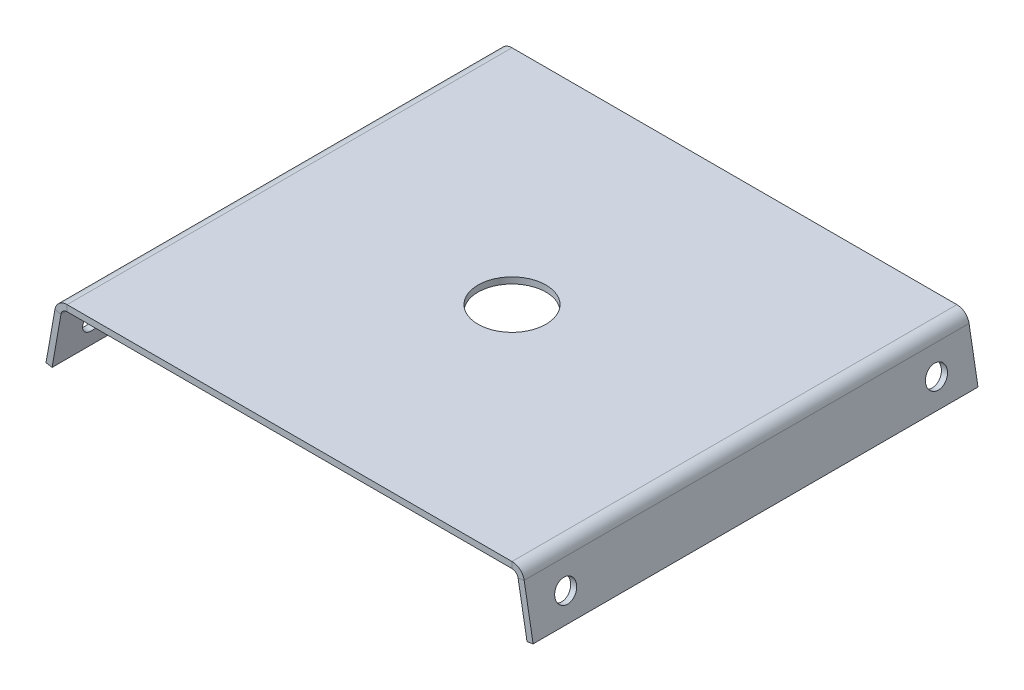
from build123d import *

# Parameters (mm, degrees)
SKETCH5_W               = 228.6
SKETCH5_H               = 228.6
SKETCH5_R               = 17.4625
BOSS_EXTRUDE3_DEPTH     = 3.175
EDGE_FLANGE1_DEPTH      = 228.6
EDGE_FLANGE1_BEND_DEPTH = 228.6
SKETCH17_R              = 5.588
CUT_EXTRUDE1_DEPTH      = 3.175


# Sheet-metal steps are written as plain solids
with BuildPart() as part:
    # Sketch5 → Boss-Extrude3 (new body)
    with BuildSketch(Plane(origin=(0, 0, 0), x_dir=(1, 0, 0), z_dir=(0, 1, 0))):
        Rectangle(SKETCH5_W, SKETCH5_H)
        with Locations(Location((0, 0, 0), (0, 0, 270))):
            Circle(SKETCH5_R, mode=Mode.SUBTRACT)
    extrude(amount=BOSS_EXTRUDE3_DEPTH)

    # Edge-Flange1 section (across the edge) → Edge-Flange1 (add)
    with BuildSketch(Plane(origin=(116.964141329, 0, -114.3), x_dir=(-0.9848077530122075, -0.17364817766693427, 0), z_dir=(0, 0, 1))):
        with BuildLine():
            Line((-3.175, 2.664141329), (-3.175, 29.085858671))
            Line((-3.175, 29.085858671), (0, 29.085858671))
            Line((0, 29.085858671), (0, 2.664141329))
            ThreePointArc((0, 2.664141329), (0.742808893, 0.623290668), (2.623667036, -0.462623287))
            Line((2.623667036, -0.462623287), (2.072334072, -3.589387903))
            ThreePointArc((2.072334072, -3.589387903), (-1.689382214, -1.417559993), (-3.175, 2.664141329))
        make_face()
    extrude(amount=EDGE_FLANGE1_DEPTH)

    # Edge-Flange1 section 2 (across the edge) → Edge-Flange1 bend (add)
    with BuildSketch(Plane(origin=(-116.964141329, 0, 114.3), x_dir=(0.9848077530122075, -0.17364817766693427, 0), z_dir=(0, 0, -1))):
        with BuildLine():
            Line((-3.175, 2.664141329), (-3.175, 29.085858671))
            Line((-3.175, 29.085858671), (0, 29.085858671))
            Line((0, 29.085858671), (0, 2.664141329))
            ThreePointArc((0, 2.664141329), (0.742808893, 0.623290668), (2.623667036, -0.462623287))
            Line((2.623667036, -0.462623287), (2.072334072, -3.589387903))
            ThreePointArc((2.072334072, -3.589387903), (-1.689382214, -1.417559993), (-3.175, 2.664141329))
        make_face()
    extrude(amount=EDGE_FLANGE1_BEND_DEPTH)

    # Sketch17 → Cut-Extrude1 (cut)
    with BuildSketch(Plane(origin=(116.564005532, 20.553379155, 0), x_dir=(0, 0, -1), z_dir=(0.9848077530122075, 0.17364817766693408, 0))):
        with Locations(Location((-95.25, -36.185609994, 0), (0, 0, 90))):
            Circle(SKETCH17_R)
        with Locations(Location((95.25, -36.185609994, 0), (0, 0, 90))):
            Circle(SKETCH17_R)
    cut_extrude1 = extrude(amount=-CUT_EXTRUDE1_DEPTH, mode=Mode.SUBTRACT)

    # Mirror1: Cut-Extrude1 across plane
    add(cut_extrude1.mirror(Plane(origin=(0, 0, 0), x_dir=(0, 0, 1), z_dir=(1, 0, 0))), mode=Mode.SUBTRACT)


solid = part.part
